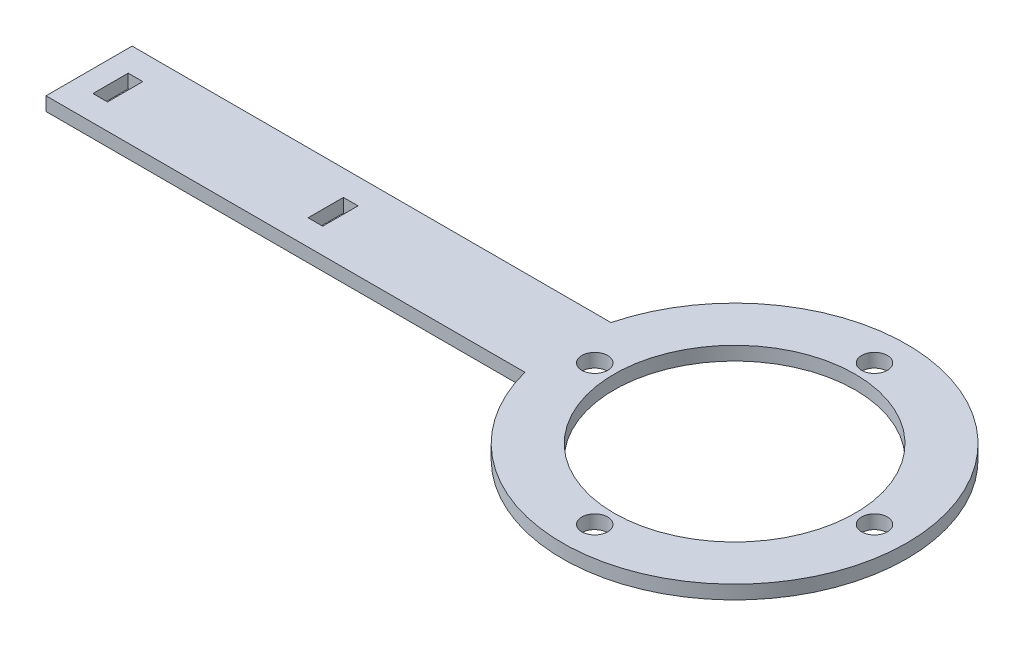
from build123d import *

# Parameters (mm, degrees)
SKETCH1_W           = 3.4
SKETCH1_H           = 8.2
SKETCH1_R           = 3
SKETCH1_R_2         = 28
BOSS_EXTRUDE1_DEPTH = 3.175


with BuildPart() as part:
    # Sketch1 → Boss-Extrude1 (new body)
    with BuildSketch(Plane(origin=(0, 0, 0), x_dir=(1, 0, 0), z_dir=(0, 1, 0))):
        with BuildLine():
            ThreePointArc((-38.729833462, -10), (40, 0), (-38.729833462, 10))
            Line((-38.729833462, 10), (-150, 10))
            Line((-150, 10), (-150, -10))
            Line((-150, -10), (-38.729833462, -10))
        make_face()
        with Locations((-143.3, 0)):
            Rectangle(SKETCH1_W, SKETCH1_H, mode=Mode.SUBTRACT)
        with Locations((-93.3, 0)):
            Rectangle(SKETCH1_W, SKETCH1_H, mode=Mode.SUBTRACT)
        with Locations((0, 32.5)):
            Circle(SKETCH1_R, mode=Mode.SUBTRACT)
        with Locations((0, -32.5)):
            Circle(SKETCH1_R, mode=Mode.SUBTRACT)
        with Locations((-32.5, 0)):
            Circle(SKETCH1_R, mode=Mode.SUBTRACT)
        Circle(SKETCH1_R_2, mode=Mode.SUBTRACT)
        with Locations((32.5, 0)):
            Circle(SKETCH1_R, mode=Mode.SUBTRACT)
    extrude(amount=BOSS_EXTRUDE1_DEPTH)


solid = part.part
